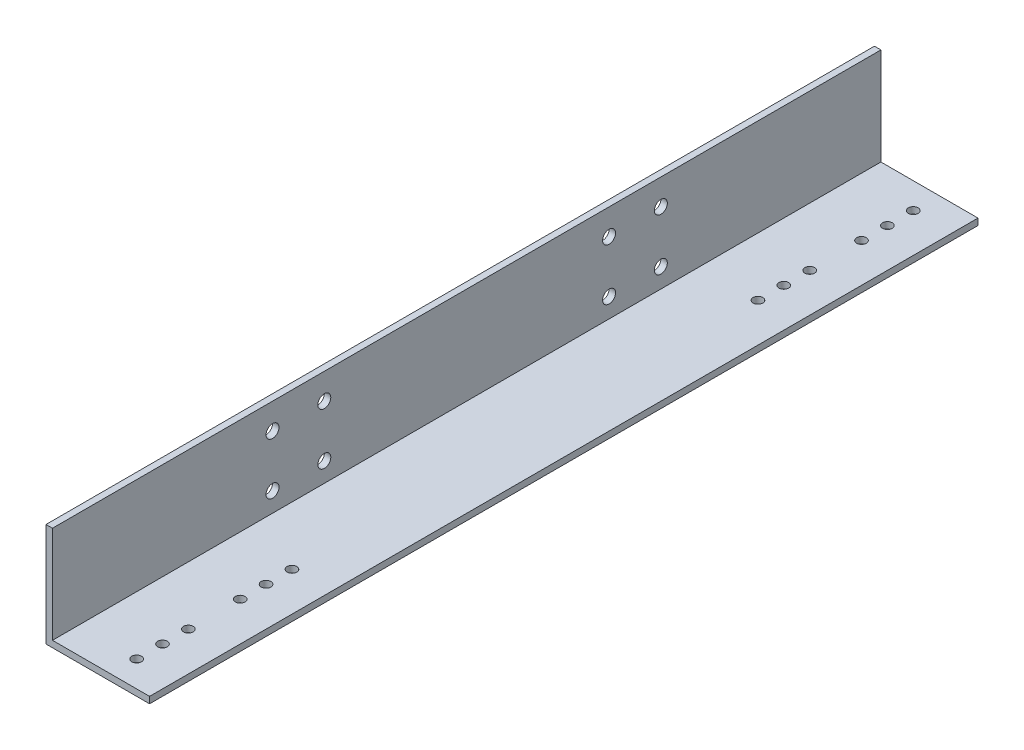
from build123d import *

# Parameters (mm, degrees)
BOSS_EXTRUDE1_DEPTH = 406.4
SKETCH2_R           = 2.38125
CUT_EXTRUDE1_DEPTH  = 413.322374635
SKETCH3_R           = 3.175
CUT_EXTRUDE2_DEPTH  = 413.701150956


with BuildPart() as part:
    # Sketch1 → Boss-Extrude1 (new body)
    with BuildSketch(Plane.XY):
        Polygon((0, 0), (50.8, 0), (50.8, 3.175), (3.175, 3.175), (3.175, 50.8), (0, 50.8), align=None)
    extrude(amount=BOSS_EXTRUDE1_DEPTH)

    # Sketch2 → Cut-Extrude1 (cut, through all)
    with BuildSketch(Plane(origin=(0, 3.175, 0), x_dir=(1, 0, 0), z_dir=(0, 1, 0))):
        with Locations((31.75, -393.7)):
            Circle(SKETCH2_R)
        with Locations((31.75, -381)):
            Circle(SKETCH2_R)
        with Locations((31.75, -368.3)):
            Circle(SKETCH2_R)
        with Locations((31.75, -317.5)):
            Circle(SKETCH2_R)
        with Locations((31.75, -330.2)):
            Circle(SKETCH2_R)
        with Locations((31.75, -342.9)):
            Circle(SKETCH2_R)
        with Locations((31.75, -12.7)):
            Circle(SKETCH2_R)
        with Locations((31.75, -25.4)):
            Circle(SKETCH2_R)
        with Locations((31.75, -38.1)):
            Circle(SKETCH2_R)
        with Locations((31.75, -63.5)):
            Circle(SKETCH2_R)
        with Locations((31.75, -76.2)):
            Circle(SKETCH2_R)
        with Locations((31.75, -88.9)):
            Circle(SKETCH2_R)
    extrude(amount=-CUT_EXTRUDE1_DEPTH, mode=Mode.SUBTRACT)

    # Sketch3 → Cut-Extrude2 (cut, through all)
    with BuildSketch(Plane.ZY):
        with Locations((107.95, 38.1)):
            Circle(SKETCH3_R)
        with Locations((133.35, 38.1)):
            Circle(SKETCH3_R)
        with Locations((107.95, 12.7)):
            Circle(SKETCH3_R)
        with Locations((133.35, 12.7)):
            Circle(SKETCH3_R)
        with Locations((273.05, 12.7)):
            Circle(SKETCH3_R)
        with Locations((298.45, 12.7)):
            Circle(SKETCH3_R)
        with Locations((273.05, 38.1)):
            Circle(SKETCH3_R)
        with Locations((298.45, 38.1)):
            Circle(SKETCH3_R)
    extrude(amount=-CUT_EXTRUDE2_DEPTH, mode=Mode.SUBTRACT)


solid = part.part
